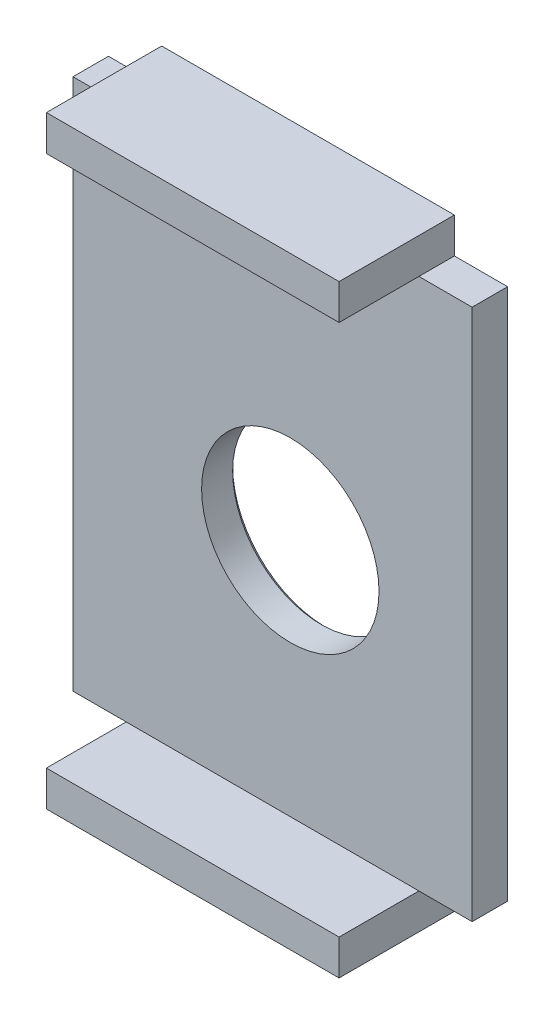
from build123d import *

# Parameters (mm, degrees)
SKETCH1_W           = 45
SKETCH1_H           = 60
SKETCH1_R           = 10
BOSS_EXTRUDE1_DEPTH = 2
SKETCH3_W           = 33
SKETCH3_H           = 4
BOSS_EXTRUDE3_DEPTH = 13
CHAMFER1_SIZE       = 0.5


with BuildPart() as part:
    # Sketch1 → Boss-Extrude1 (new, symmetric)
    with BuildSketch(Plane.XY):
        Rectangle(SKETCH1_W, SKETCH1_H)
        with Locations((2, -3)):
            Circle(SKETCH1_R, mode=Mode.SUBTRACT)
    extrude(amount=BOSS_EXTRUDE1_DEPTH, both=True)

    # Sketch3 → Boss-Extrude3 (add)
    with BuildSketch(Plane(origin=(0, 0, -2), x_dir=(-1, 0, 0), z_dir=(0, 0, -1))):
        with Locations((0, 32)):
            Rectangle(SKETCH3_W, SKETCH3_H)
        with Locations((0, -32)):
            Rectangle(SKETCH3_W, SKETCH3_H)
    extrude(amount=-BOSS_EXTRUDE3_DEPTH)

    # Chamfer1
    chamfer1_edges = [part.edges().sort_by_distance(p)[0] for p in [
        (-8, -3, -2),
    ]]
    chamfer(chamfer1_edges, length=CHAMFER1_SIZE)


solid = part.part
